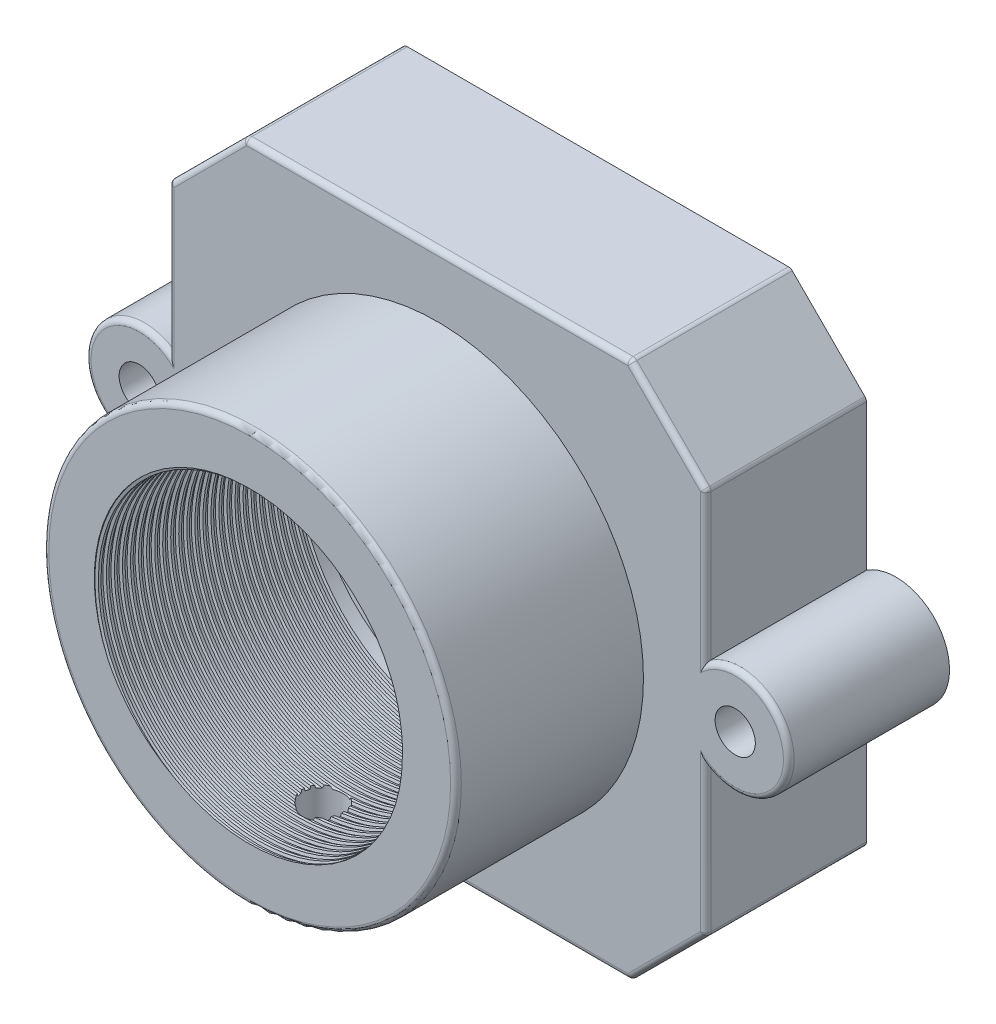
from build123d import *

# Parameters (mm, degrees)
EXTRUDE_1_DEPTH     = 6
CUT_EXTRUDE_1_DEPTH = 1.5
MM_1_D              = 1.5
SKETCH_4_R          = 5.7
EXTRUDE_2_DEPTH     = 1
EXTRUDE_START       = 7
SKETCH_5_R          = 7.7
SKETCH_5_R_2        = 5.7
EXTRUDE_3_DEPTH     = 7
MM_2_D              = 1.5
MM_2_DEPTH          = 4.340428852
FILLET_1_R          = 0.2
SWEEP_1_PITCH       = 0.3


with BuildPart() as part:
    # 草图1 → 凸台-拉伸1 (new body)
    with BuildSketch(Plane.XY):
        with BuildLine():
            Line((10.025, -7.196572875), (7.196572875, -10.025))
            Line((7.196572875, -10.025), (-7.196572875, -10.025))
            Line((-7.196572875, -10.025), (-10.025, -7.196572875))
            Line((-10.025, -7.196572875), (-10.025, -1.670329309))
            ThreePointArc((-10.025, -1.670329309), (-13.125, 0), (-10.025, 1.670329309))
            Line((-10.025, 1.670329309), (-10.025, 7.196572875))
            Line((-10.025, 7.196572875), (-7.196572875, 10.025))
            Line((-7.196572875, 10.025), (7.196572875, 10.025))
            Line((7.196572875, 10.025), (10.025, 7.196572875))
            Line((10.025, 7.196572875), (10.025, 1.670329309))
            ThreePointArc((10.025, 1.670329309), (13.125, 0), (10.025, -1.670329309))
            Line((10.025, -1.670329309), (10.025, -7.196572875))
        make_face()
        Polygon((-8.825, 6.6995166), (-8.825, -6.6995166), (-6.6995166, -8.825), (6.6995166, -8.825), (8.825, -6.6995166), (8.825, 6.6995166), (6.6995166, 8.825), (-6.6995166, 8.825), align=None, mode=Mode.SUBTRACT)
    extrude(amount=EXTRUDE_1_DEPTH)

    # 草图2 → 切除-拉伸1 (cut)
    with BuildSketch(Plane(origin=(0, 0, 0), x_dir=(-1, 0, 0), z_dir=(0, 0, -1))):
        Polygon((-6.865202025, 9.225), (6.865202025, 9.225), (9.225, 6.865202025), (9.225, -6.865202025), (6.865202025, -9.225), (-6.865202025, -9.225), (-9.225, -6.865202025), (-9.225, 6.865202025), align=None)
        Polygon((6.6995166, 8.825), (8.825, 6.6995166), (8.825, -6.6995166), (6.6995166, -8.825), (-6.6995166, -8.825), (-8.825, -6.6995166), (-8.825, 6.6995166), (-6.6995166, 8.825), align=None, mode=Mode.SUBTRACT)
    extrude(amount=-CUT_EXTRUDE_1_DEPTH, mode=Mode.SUBTRACT)

    # 大小mm 暗销孔1 (through all)
    with Locations(Plane(origin=(11.125, 0, 0), x_dir=(-1, 0, 0), z_dir=(0, 0, -1))):
        with Locations((0, 0), (22.25, 0)):
            Hole(MM_1_D / 2)

    # 草图4 → 凸台-拉伸2 (add)
    with BuildSketch(Plane.XY.offset(6)):
        Polygon((-8.825, 6.6995166), (-8.825, -6.6995166), (-6.6995166, -8.825), (6.6995166, -8.825), (8.825, -6.6995166), (8.825, 6.6995166), (6.6995166, 8.825), (-6.6995166, 8.825), align=None)
        Circle(SKETCH_4_R, mode=Mode.SUBTRACT)
    extrude(amount=-EXTRUDE_2_DEPTH)

    # 草图5 → 凸台-拉伸3 (add)
    with BuildSketch(Plane.XY.offset(6).offset(EXTRUDE_START)):
        Circle(SKETCH_5_R)
        Circle(SKETCH_5_R_2, mode=Mode.SUBTRACT)
    extrude(amount=-EXTRUDE_3_DEPTH)

    # 大小mm 暗销孔2
    with Locations(Plane(origin=(0.006703541, -5.699996058, 10.270340525), x_dir=(0.999999308441, 0.001176059794, 0), z_dir=(-0.001176059794, 0.999999308441, 0))):
        with Locations((0, 0)):
            Hole(MM_2_D / 2, depth=MM_2_DEPTH)

    # 圆角1
    fillet_1_edges = [part.edges().sort_by_distance(p)[0] for p in [
        (10.025, 4.433451092, 6),
        (8.610786438, 8.610786438, 6),
        (-7.7, 0, 13),
        (0, 10.025, 6),
        (-8.610786438, 8.610786438, 6),
        (10.025, -7.196572875, 3),
        (7.196572875, -10.025, 3),
        (-7.196572875, -10.025, 3),
        (-10.025, -7.196572875, 3),
        (-10.025, 7.196572875, 3),
        (-7.196572875, 10.025, 3),
        (7.196572875, 10.025, 3),
        (10.025, 7.196572875, 3),
        (-10.025, 4.433451092, 6),
        (-13.125, 0, 6),
        (-10.025, -4.433451092, 6),
        (-8.610786438, -8.610786438, 6),
        (0, -10.025, 6),
        (8.610786438, -8.610786438, 6),
        (10.025, -4.433451092, 6),
        (13.125, 0, 6),
    ]]
    fillet(fillet_1_edges, radius=FILLET_1_R)

    # 切除-扫描1: arcs per turn and ends read off the stored shape
    # 切除-扫描1: the profile of 草图12 profile screwed along a right-hand helix through 26 turns, 6 arcs to a turn; built about Z, then put on its axis
    sweep_1_z = Axis((0, 0, 0), (0, 0, 1))
    sweep_1_corners = [(5.6997, 0, -0.30009), (5.8, 0, -0.27), (5.8, 0, -0.13), (5.6997, 0, -0.09991)]
    with BuildLine(mode=Mode.PRIVATE) as sweep_1_profile:
        Line(sweep_1_corners[0], sweep_1_corners[1])
        Line(sweep_1_corners[1], sweep_1_corners[2])
        Line(sweep_1_corners[2], sweep_1_corners[3])
        Line(sweep_1_corners[3], sweep_1_corners[0])
    sweep_1_cap = Face(sweep_1_profile.wire())
    sweep_1_turn_angles = [0, 30, 60, 90, 120, 150, 180, 210, 240, 270, 300, 330, 360]
    sweep_1_turn_weights = [1, 0.8660254037844387, 1, 0.8660254037844387, 1, 0.8660254037844387, 1, 0.8660254037844387, 1, 0.8660254037844387, 1, 0.8660254037844387, 1]
    sweep_1_turn_rails = [Edge.make_bspline([Vector(p[0], p[1], 0).rotate(sweep_1_z, sweep_1_turn_angles[k]) / sweep_1_turn_weights[k] + Vector(0, 0, p[2] + SWEEP_1_PITCH * sweep_1_turn_angles[k] / 360) for k in range(13)], [0, 0, 0, 1, 1, 2, 2, 3, 3, 4, 4, 5, 5, 6, 6, 6], 2, sweep_1_turn_weights) for p in sweep_1_corners]
    sweep_1_turn_sides = [Face.make_surface_from_curves(sweep_1_turn_rails[p[0]], sweep_1_turn_rails[p[1]]) for p in [(0, 1), (1, 2), (2, 3), (3, 0)]]
    sweep_1 = Plane(origin=(0, 0, 13), x_dir=(1, 0, 0), z_dir=(0, 0, -1)) * Solid(Shell([*[p.moved(Location((0, 0, SWEEP_1_PITCH * i))) for i in range(26) for p in sweep_1_turn_sides], sweep_1_cap, sweep_1_cap.rotate(sweep_1_z, 9360).moved(Location((0, 0, SWEEP_1_PITCH * 9360 / 360)))]))
    add(sweep_1, mode=Mode.SUBTRACT)


solid = part.part
